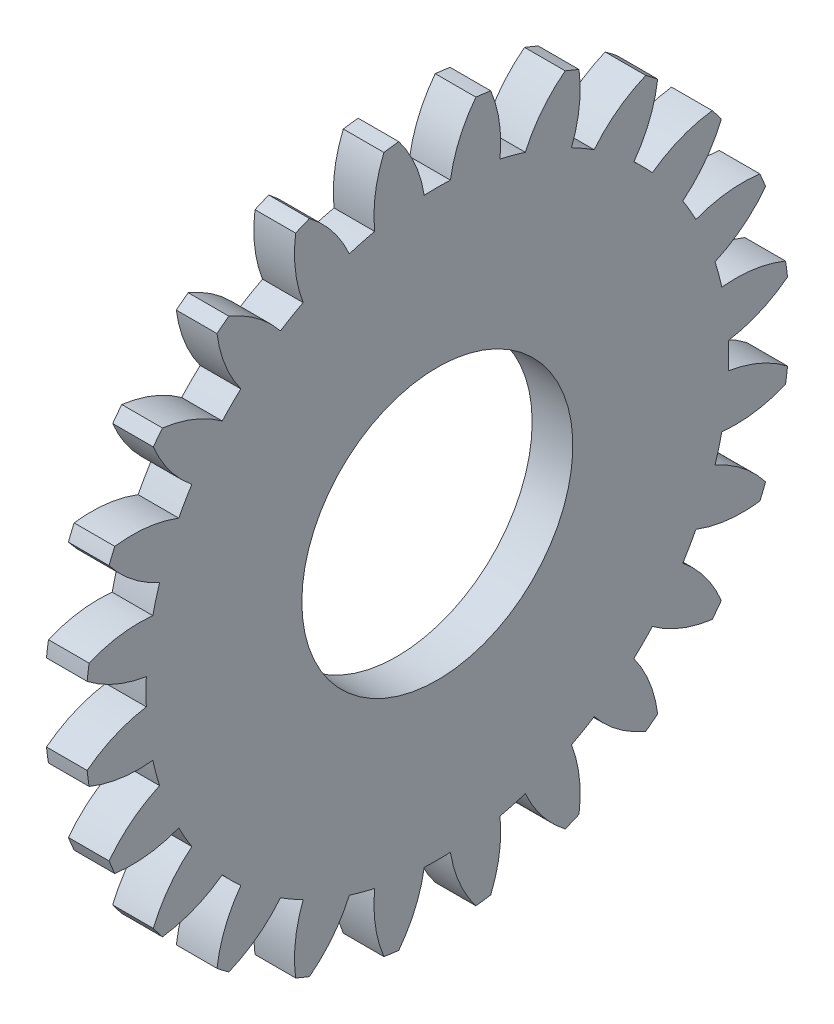
from build123d import *

# Parameters (mm, degrees)
BASPROSKE_W     = 1.5
BASPROSKE_H     = 13
TOOTHCUT_DEPTH  = 19.445866746
TEETHCUTS_COUNT = 24
TEETHCUTS_ANGLE = 345
BORSKE_R        = 5
BORE_DEPTH      = 50.0000508


with BuildPart() as part:
    # BasProSke → Base-Revolve (revolve)
    with BuildSketch(Plane(origin=(0, 0, 0), x_dir=(1, 0, 0), z_dir=(0, 1, 0))):
        with Locations((0.75, 6.5)):
            Rectangle(BASPROSKE_W, BASPROSKE_H)
    revolve(axis=Axis((-10, 0, 0), (1, 0, 0)))

    # TooCutSke → ToothCut (cut, through all)
    with BuildSketch(Plane(origin=(0, 0, 0), x_dir=(0, 0, -1), z_dir=(1, 0, 0))):
        with BuildLine():
            ThreePointArc((0.483448384, 10.738122679), (0, 10.749), (-0.483448384, 10.738122679))
            ThreePointArc((-0.483448384, 10.738122679), (-0.821636462, 11.902754369), (-1.44092227, 12.945454344))
            ThreePointArc((-1.44092227, 12.945454344), (0, 13.0254), (1.44092227, 12.945454344))
            ThreePointArc((1.44092227, 12.945454344), (0.821636462, 11.902754369), (0.483448384, 10.738122679))
        make_face()
    toothcut = extrude(amount=TOOTHCUT_DEPTH, mode=Mode.SUBTRACT)

    # TeethCuts: ToothCut ×24 about axis
    teethcuts_axis = Axis((-10, 0, 0), (1, 0, 0))
    for i in range(1, TEETHCUTS_COUNT):
        add(toothcut.rotate(teethcuts_axis, i * TEETHCUTS_ANGLE / (TEETHCUTS_COUNT - 1)), mode=Mode.SUBTRACT)

    # BorSke → Bore (cut, symmetric)
    with BuildSketch(Plane(origin=(0, 0, 0), x_dir=(0, 0, -1), z_dir=(1, 0, 0))):
        Circle(BORSKE_R)
    extrude(amount=BORE_DEPTH, both=True, mode=Mode.SUBTRACT)


solid = part.part
